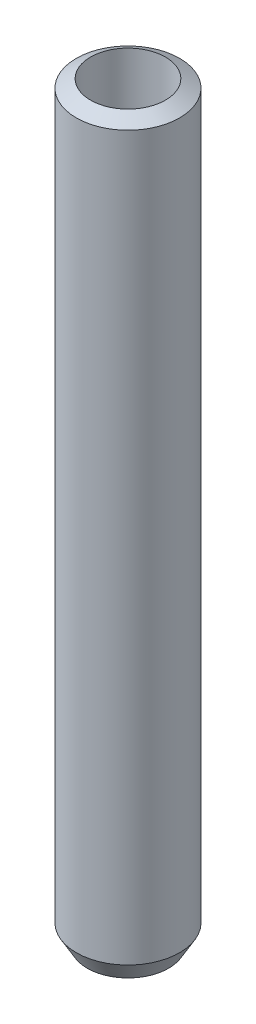
from build123d import *

# Parameters (mm, degrees)
SKETCH1_R           = 20
BOSS_EXTRUDE1_DEPTH = 291.561737
SKETCH2_R           = 14.48745524
CUT_EXTRUDE1_DEPTH  = 293.930446493
CHAMFER1_SIZE       = 4.236838
CHAMFER1_SIZE_2     = 7.338419


with BuildPart() as part:
    # Sketch1 → Boss-Extrude1 (new body)
    with BuildSketch(Plane(origin=(0, 0, 0), x_dir=(1, 0, 0), z_dir=(0, 1, 0))):
        with Locations(Location((0, 0, 0), (0, 0, 270))):
            Circle(SKETCH1_R)
    extrude(amount=BOSS_EXTRUDE1_DEPTH)

    # Sketch2 → Cut-Extrude1 (cut, through all)
    with BuildSketch(Plane(origin=(0, 0, 0), x_dir=(1, 0, 0), z_dir=(0, 1, 0))):
        with Locations(Location((0, 0, 0), (0, 0, 270))):
            Circle(SKETCH2_R)
    extrude(amount=CUT_EXTRUDE1_DEPTH, mode=Mode.SUBTRACT)

    # Chamfer1
    # the kernel refuses this chamfer: 7.338419, 4.236838 mm, written as the material it takes off along each edge
    with BuildSketch(Plane(origin=(0, 291.561737, 0), x_dir=(0, 0, 1), z_dir=(-1, 0, 0))) as chamfer1_piece_1:
        Polygon((20, -CHAMFER1_SIZE), (20 - CHAMFER1_SIZE_2, 0), (20, 0), align=None)
    revolve(axis=Axis((0, 291.561737, 0), (0, 1, 0)), mode=Mode.SUBTRACT)
    with BuildSketch(Plane(origin=(0, 0, 0), x_dir=(0, 0, 1), z_dir=(-1, 0, 0))) as chamfer1_piece_2:
        Polygon((20, CHAMFER1_SIZE_2), (20 - CHAMFER1_SIZE, 0), (20, 0), align=None)
    revolve(axis=Axis((0, 0, 0), (0, 1, 0)), mode=Mode.SUBTRACT)


solid = part.part
